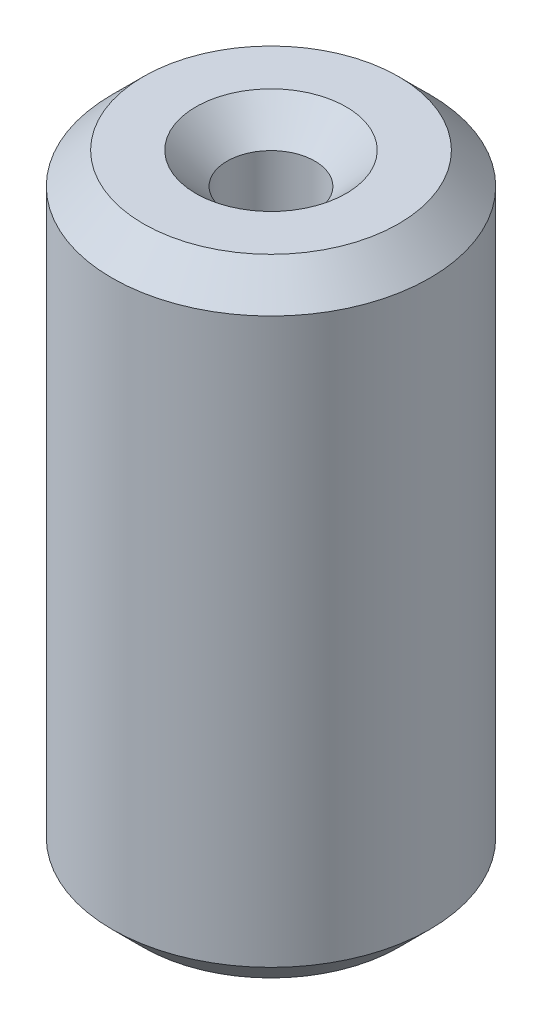
from build123d import *

# Parameters (mm, degrees)
SKETCH1_R           = 5
BOSS_EXTRUDE1_DEPTH = 19.720248155
SKETCH2_R           = 1.378773955
CUT_EXTRUDE1_DEPTH  = 21.949658405
CHAMFER1_SIZE       = 0.985582819


with BuildPart() as part:
    # Sketch1 → Boss-Extrude1 (new body)
    with BuildSketch(Plane(origin=(0, 0, 0), x_dir=(1, 0, 0), z_dir=(0, 1, 0))):
        Circle(SKETCH1_R)
    extrude(amount=BOSS_EXTRUDE1_DEPTH)

    # Sketch2 → Cut-Extrude1 (cut, through all)
    with BuildSketch(Plane(origin=(0, 0, 0), x_dir=(1, 0, 0), z_dir=(0, 1, 0))):
        Circle(SKETCH2_R)
    extrude(amount=CUT_EXTRUDE1_DEPTH, mode=Mode.SUBTRACT)

    # Chamfer1
    chamfer1_edges = [part.edges().sort_by_distance(p)[0] for p in [
        (-1.378773955, 19.720248155, 0),
        (-1.378773955, 0, 0),
        (-5, 0, 0),
        (-5, 19.720248155, 0),
    ]]
    chamfer(chamfer1_edges, length=CHAMFER1_SIZE)


solid = part.part
